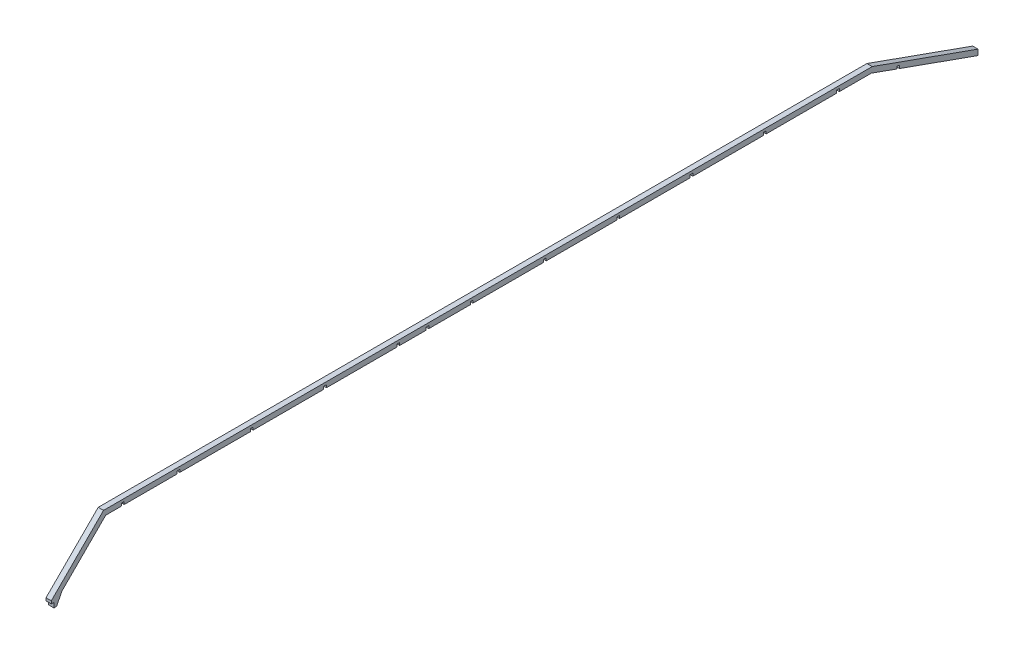
from build123d import *

# Parameters (mm, degrees)
EXTRUDE_3_DEPTH = 6


with BuildPart() as part:
    # Эскиз1 → Бобышка-Вытянуть3 (new body)
    with BuildSketch(Plane(origin=(0, 0, 0), x_dir=(0, 0, -1), z_dir=(1, 0, 0))):
        Polygon((-751.886625415, -19.142158624), (-733.960587786, -19.142158624), (-733.960587786, -16.142158624), (-730.960587786, -16.142158624), (-730.960587786, -19.142158624), (-670.960587786, -19.142158624), (-670.960587786, -16.142158624), (-667.960587786, -16.142158624), (-667.960587786, -19.142158624), (-587.960587786, -19.142158624), (-587.960587786, -16.142158624), (-584.960587786, -16.142158624), (-584.960587786, -19.142158624), (-504.960587786, -19.142158624), (-504.960587786, -16.142158624), (-501.960587786, -16.142158624), (-501.960587786, -19.142158624), (-421.960587786, -19.142158624), (-421.960587786, -16.142158624), (-418.960587786, -16.142158624), (-418.960587786, -19.142158624), (-388.960587786, -19.142158624), (-388.960587786, -16.142158624), (-385.960587786, -16.142158624), (-385.960587786, -19.142158624), (-338.960587786, -19.142158624), (-338.960587786, -16.142158624), (-335.960587786, -16.142158624), (-335.960587786, -19.142158624), (-255.960587786, -19.142158624), (-255.960587786, -16.142158624), (-252.960587786, -16.142158624), (-252.960587786, -19.142158624), (-172.960587786, -19.142158624), (-172.960587786, -16.142158624), (-169.960587786, -16.142158624), (-169.960587786, -19.142158624), (-89.960587786, -19.142158624), (-89.960587786, -16.142158624), (-86.960587786, -16.142158624), (-86.960587786, -19.142158624), (-6.960587786, -19.142158624), (-6.960587786, -16.142158624), (-3.960587786, -16.142158624), (-3.960587786, -19.142158624), (76.039412214, -19.142158624), (76.039412214, -16.142158624), (79.039412214, -16.142158624), (79.039412214, -19.142158624), (115.173374585, -19.142158624), (144.039412214, -29.449285501), (144.039412214, -26.449285501), (147.039412214, -27.520488312), (147.039412214, -30.520488312), (236.039412214, -62.299505021), (236.039412214, -55.928484549), (116.212450849, -13.142158624), (-754.371906789, -13.142158624), (-813.525123531, -72.295375365), (-813.525123531, -75.295375365), (-810.525123531, -75.295375365), (-810.525123531, -80.78065674), (-807.525123531, -80.78065674), (-801.525123531, -68.78065674), align=None)
    extrude(amount=EXTRUDE_3_DEPTH)


solid = part.part
